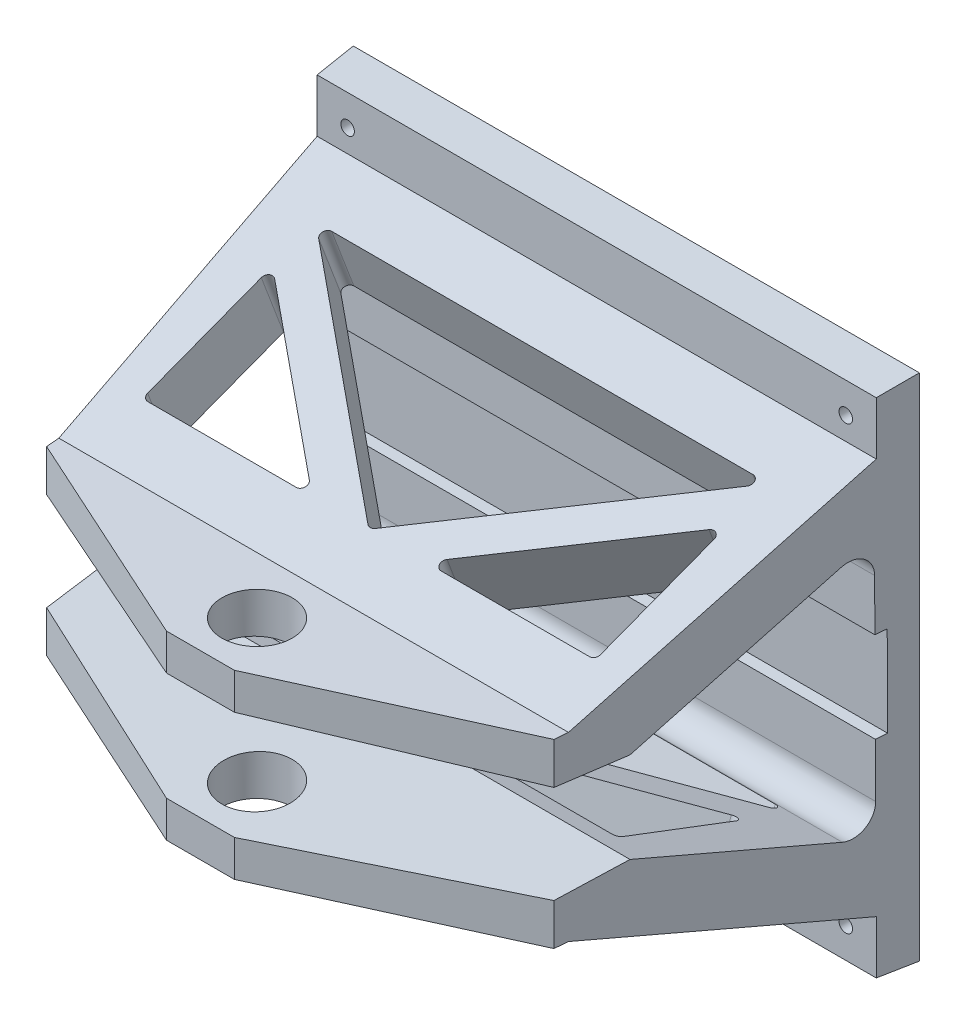
from build123d import *

# Parameters (mm, degrees)
SKETCH3_W           = 114.3
SKETCH3_H           = 127
BOSS_EXTRUDE1_DEPTH = 8.89
SKETCH5_R           = 1.524
CUT_EXTRUDE1_DEPTH  = 172.092145056
SHELL2_T            = -6.35
SKETCH6_W           = 88.9
SKETCH6_H           = 127
BOSS_EXTRUDE2_DEPTH = 88.9
SKETCH8_R           = 7.874
CUT_EXTRUDE2_DEPTH  = 190.774719338
CUT_EXTRUDE3_DEPTH  = 197.866386415
FILLET1_R           = 5.08
CUT_EXTRUDE4_DEPTH  = 165.086159295
CUT_EXTRUDE5_DEPTH  = 190.725297655
FILLET2_R           = 1.27
SKETCH20_W          = 127
SKETCH20_H          = 20.338660629
CUT_EXTRUDE7_DEPTH  = 2.54
DRAFT6_DEPTH        = 114.3
DRAFT6_START        = -128
DRAFT6_2_DEPTH      = 129
DRAFT7_ANGLE        = 3


with BuildPart() as part:
    # Sketch3 → Boss-Extrude1 (new body)
    with BuildSketch(Plane(origin=(0, 0, 0), x_dir=(0, 1, 0), z_dir=(0, 0, 1))):
        with Locations((57.15, 63.5)):
            Rectangle(SKETCH3_W, SKETCH3_H)
    extrude(amount=BOSS_EXTRUDE1_DEPTH)

    # Sketch5 → Cut-Extrude1 (cut, through all)
    with BuildSketch(Plane.XY.offset(8.89)):
        with Locations((-119.38, 7.62)):
            Circle(SKETCH5_R)
        with Locations((-7.62, 7.62)):
            Circle(SKETCH5_R)
        with Locations((-119.38, 106.68)):
            Circle(SKETCH5_R)
        with Locations((-7.62, 106.68)):
            Circle(SKETCH5_R)
    extrude(amount=-CUT_EXTRUDE1_DEPTH, mode=Mode.SUBTRACT)

    # Shell2
    shell2_openings = [part.faces().sort_by_distance(p)[0] for p in [
        (-63.5, 57.15, 0),
    ]]
    offset(amount=SHELL2_T, openings=shell2_openings)

    # Sketch6 → Boss-Extrude2 (add)
    with BuildSketch(Plane(origin=(0, 0, 8.89), x_dir=(0, -1, 0), z_dir=(0, 0, 1))):
        with Locations((-57.15, -63.5)):
            Rectangle(SKETCH6_W, SKETCH6_H)
    extrude(amount=BOSS_EXTRUDE2_DEPTH)

    # Sketch8 → Cut-Extrude2 (cut, through all)
    with BuildSketch(Plane(origin=(0, 101.6, 0), x_dir=(-1, 0, 0), z_dir=(0, 1, 0))):
        with Locations(Location((63.5, 85.09, 0), (0, 0, 90))):
            Circle(SKETCH8_R)
        Polygon((55.88, 97.79), (0, 97.79), (0, 72.39), align=None)
        Polygon((71.12, 97.79), (127, 97.79), (127, 72.39), align=None)
    extrude(amount=-CUT_EXTRUDE2_DEPTH, mode=Mode.SUBTRACT)

    # Sketch9 → Cut-Extrude3 (cut, through all)
    with BuildSketch(Plane(origin=(-127, 0, 0), x_dir=(0, -1, 0), z_dir=(-1, 0, 0))):
        Polygon((-67.31, 97.79), (-46.99, 97.79), (-46.99, 59.69), (-27.718040346, 8.974316699), (-86.47043568, 9.267800843), (-67.31, 59.69), align=None)
        Polygon((-77.47, 97.79), (-77.47, 72.39), (-101.6, 8.89), (-101.6, 97.79), align=None)
        Polygon((-36.83, 97.79), (-36.83, 72.39), (-12.7, 8.89), (-12.7, 97.79), align=None)
    extrude(amount=-CUT_EXTRUDE3_DEPTH, mode=Mode.SUBTRACT)

    # Fillet1
    fillet1_edges = [part.edges().sort_by_distance(p)[0] for p in [
        (-63.5, 27.718040346, 8.974316699),
        (-63.5, 86.47043568, 9.267800843),
    ]]
    fillet(fillet1_edges, radius=FILLET1_R)

    # Sketch16 → Cut-Extrude4 (cut, through all)
    with BuildSketch(Plane(origin=(0, 78.63701503, 29.882065711), x_dir=(1, 0, 0), z_dir=(0, -0.9347835805883491, -0.3552177606235725))):
        Polygon((-12.7, -14.726847163), (-114.3, -14.726847163), (-63.5, 26.915400792), align=None)
        Polygon((-12.7, 26.915400792), (-50.8, 26.915400792), (-12.7, -4.316285174), align=None)
        Polygon((-114.3, -4.316285174), (-114.3, 26.915400792), (-76.2, 26.915400792), align=None)
    extrude(amount=-CUT_EXTRUDE4_DEPTH, mode=Mode.SUBTRACT)

    # Sketch17 → Cut-Extrude5 (cut, through all)
    with BuildSketch(Plane(origin=(0, 21.240650122, -8.071447046), x_dir=(-1, 0, 0), z_dir=(0, 0.934783580588349, -0.3552177606235728))):
        Polygon((114.3, 25.842533623), (12.7, 25.842533623), (63.5, 67.484781577), align=None)
        Polygon((114.3, 67.484781577), (76.2, 67.484781577), (114.3, 36.253095611), align=None)
        Polygon((12.7, 36.253095611), (12.7, 67.484781577), (50.8, 67.484781577), align=None)
    extrude(amount=-CUT_EXTRUDE5_DEPTH, mode=Mode.SUBTRACT)

    # Fillet2
    fillet2_edges = [part.edges().sort_by_distance(p)[0] for p in [
        (-76.2, 75.623722461, 57.530204051),
        (-114.3, 86.71777201, 28.335336816),
        (-114.3, 75.623722461, 57.530204051),
        (-12.7, 75.623722461, 57.530204051),
        (-12.7, 86.71777201, 28.335336816),
        (-50.8, 75.623722461, 57.530204051),
        (-12.7, 90.415788526, 18.603714404),
        (-63.5, 75.623722461, 57.530204051),
        (-114.3, 90.415788526, 18.603714404),
        (-50.8, 38.664907284, 57.500282325),
        (-12.7, 27.570857734, 28.30541509),
        (-12.7, 38.664907284, 57.500282325),
        (-114.3, 38.664907284, 57.500282325),
        (-114.3, 27.570857734, 28.30541509),
        (-76.2, 38.664907284, 57.500282325),
        (-63.5, 38.664907284, 57.500282325),
        (-114.3, 23.872841218, 18.573792679),
        (-12.7, 23.872841218, 18.573792679),
        (-120.65, 57.15, 2.54),
    ]]
    fillet(fillet2_edges, radius=FILLET2_R)

    # Sketch20 → Cut-Extrude7 (cut)
    with BuildSketch(Plane(origin=(0, -0.044136403, 8.8356371), x_dir=(1, 0, 0), z_dir=(0, -0.004995208795198877, 0.9999875238667193))):
        with Locations((-63.5, 57.456908074)):
            Rectangle(SKETCH20_W, SKETCH20_H)
    extrude(amount=-CUT_EXTRUDE7_DEPTH, mode=Mode.SUBTRACT)

    # Draft6: read off the stored shape, not the designer's step
    # Draft6 outline → Draft6 (cut)
    with BuildSketch(Plane(origin=(0, 0, 0), x_dir=(1, 0, 0), z_dir=(0, 1, 0))):
        Polygon((-120.404404826, -75.387997806), (-127, 0), (-127, -72.39), align=None)
        Polygon((0, 0), (-6.595595174, -75.387997806), (0, -72.39), align=None)
    extrude(amount=DRAFT6_DEPTH, mode=Mode.SUBTRACT)

    # Draft6 2 outline → Draft6 2 (cut)
    with BuildSketch(Plane.YZ.offset(DRAFT6_START)):
        Polygon((0, 0), (0.777774219, 8.89), (0, 8.89), align=None)
        Polygon((113.522225781, 8.89), (114.3, 0), (114.3, 8.89), align=None)
    extrude(amount=DRAFT6_2_DEPTH, mode=Mode.SUBTRACT)

    # Draft7
    draft7_faces = [part.faces().sort_by_distance(p)[0] for p in [
        (-63.5, 46.99, 74.057550682),
        (-63.5, 67.31, 74.057550682),
    ]]
    draft(draft7_faces, Plane(origin=(0, 0, 59.69), x_dir=(0, 1, 0), z_dir=(0, 0, 1)), DRAFT7_ANGLE)


solid = part.part
